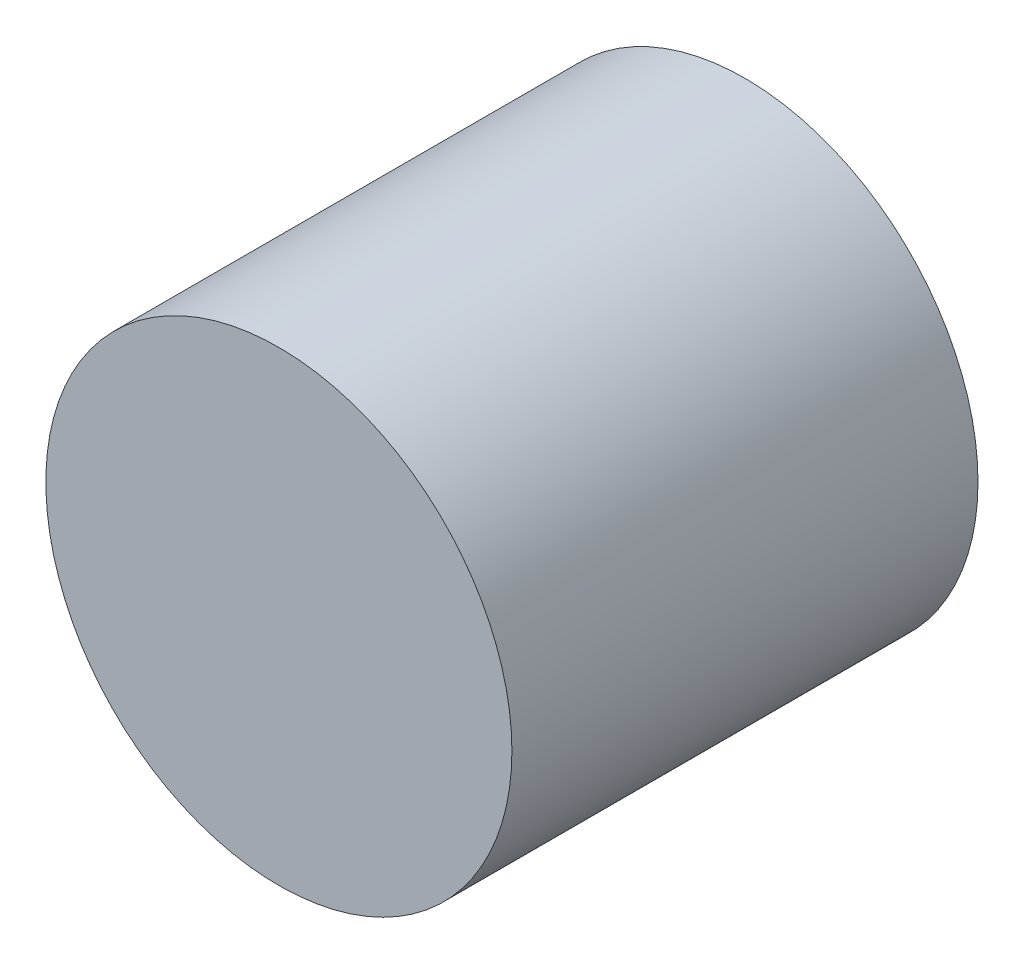
from build123d import *

# Parameters (mm, degrees)
SKETCH2_R           = 7.9375
BOSS_EXTRUDE1_DEPTH = 15.875


with BuildPart() as part:
    # Sketch2 → Boss-Extrude1 (new body)
    with BuildSketch(Plane.XY):
        Circle(SKETCH2_R)
    extrude(amount=BOSS_EXTRUDE1_DEPTH)


solid = part.part
